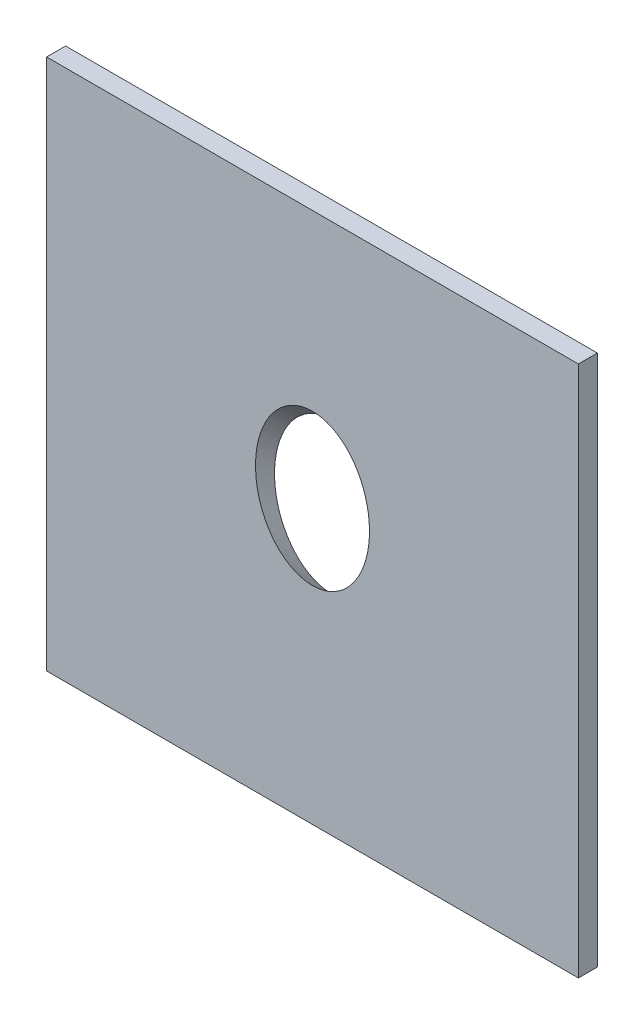
from build123d import *

# Parameters (mm, degrees)
SKETCH1_W           = 140
SKETCH1_H           = 140
BOSS_EXTRUDE1_DEPTH = 5
CAVITY1_START       = -13.043478361
CAVITY1_OUTLINE_R   = 15
CAVITY1_DEPTH       = 32.712935267


# Read off the part's stored shape, not the designer's step: Cavity1
with BuildPart() as part:
    # Sketch1 → Boss-Extrude1 (new body)
    with BuildSketch(Plane.XY):
        Rectangle(SKETCH1_W, SKETCH1_H)
    extrude(amount=BOSS_EXTRUDE1_DEPTH)

    # Cavity1 outline → Cavity1 (cut)
    with BuildSketch(Plane(origin=(0, 0, 0), x_dir=(1, 0, 0), z_dir=(0, 0.6561787149247867, 0.7546055221635047)).offset(CAVITY1_START)):
        Circle(CAVITY1_OUTLINE_R)
    extrude(amount=CAVITY1_DEPTH, mode=Mode.SUBTRACT)


solid = part.part
